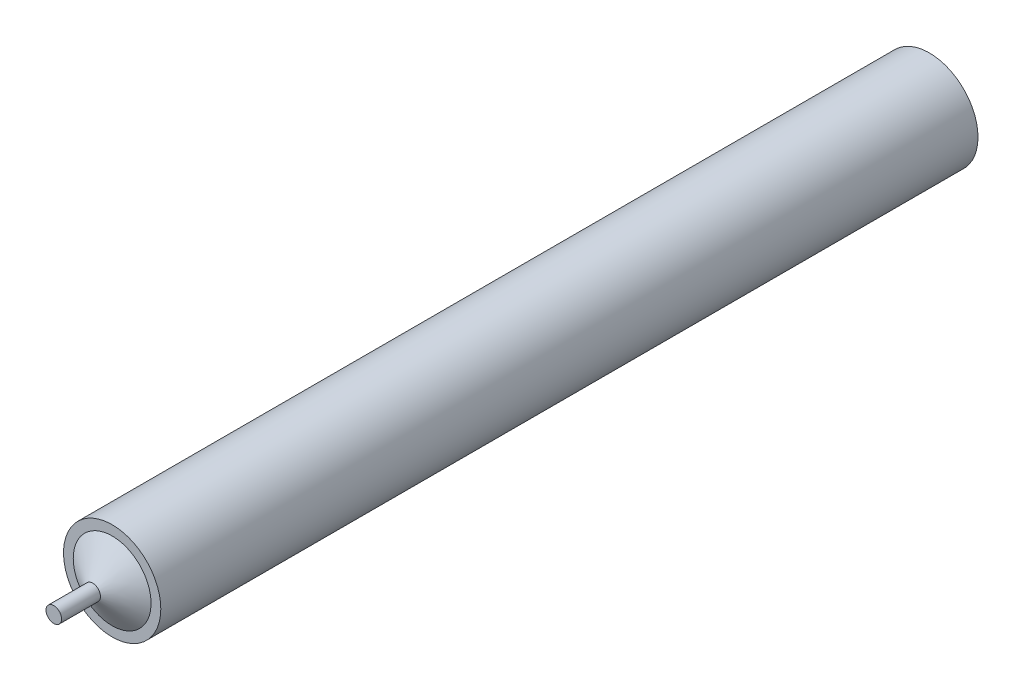
from build123d import *

# Parameters (mm, degrees)
SCHIZZO1_R                   = 25
ESTRUSIONE_ESTRUSIONE1_DEPTH = 420
SCHIZZO5_R                   = 4
SCHIZZO4_R                   = 20
SCHIZZO9_R                   = 4
ESTRUSIONE_ESTRUSIONE2_DEPTH = 20
SCHIZZO12_R                  = 2.5
TAGLIO_ESTRUSIONE2_DEPTH     = 25


with BuildPart() as part:
    # Schizzo1 → Estrusione-Estrusione1 (new body)
    with BuildSketch(Plane.XY):
        Circle(SCHIZZO1_R)
    extrude(amount=ESTRUSIONE_ESTRUSIONE1_DEPTH)

    # Schizzo5 → Loft2 section 0
    with BuildSketch(Plane.XY.offset(430)):
        Circle(SCHIZZO5_R)
    # Schizzo4 → Loft2 section 1
    with BuildSketch(Plane.XY.offset(420)):
        Circle(SCHIZZO4_R)
    loft()

    # Schizzo9 → Estrusione-Estrusione2 (add)
    with BuildSketch(Plane.XY.offset(430)):
        with Locations(Location((0, 0, 0), (0, 0, 180))):
            Circle(SCHIZZO9_R)
    extrude(amount=ESTRUSIONE_ESTRUSIONE2_DEPTH)

    # Loft3: read off the stored shape, not the designer's step
    # Loft3: loft between two sections, ruled curve by curve
    loft3_from = [
        Edge.make_bspline([(-8.012098274, 18.325017906, 0), (28.637937538, 34.349214454, 0), (44.662134086, -2.300821358, 0), (8.012098274, -18.325017906, 0), (-28.637937538, -34.349214454, 0), (-44.662134086, 2.300821358, 0), (-8.012098274, 18.325017906, 0)], [0, 0, 0, 0, 0.5, 0.5, 0.5, 1, 1, 1, 1], 3, [1, 0.333333333, 0.333333333, 1, 0.333333333, 0.333333333, 1]),
    ]
    loft3_to = [
        Edge.make_bspline([(-0.355363052, 2.474614536, -10), (4.59386602, 3.18534064, -10), (5.304592124, -1.763888432, -10), (0.355363052, -2.474614536, -10), (-4.59386602, -3.18534064, -10), (-5.304592124, 1.763888432, -10), (-0.355363052, 2.474614536, -10)], [0, 0, 0, 0, 0.5, 0.5, 0.5, 1, 1, 1, 1], 3, [1, 0.333333333, 0.333333333, 1, 0.333333333, 0.333333333, 1]),
    ]
    loft3 = Solid(Shell([*[Face.make_surface_from_curves(loft3_from[k], loft3_to[k]) for k in range(1)], Face(Wire(loft3_from)), Face(Wire(loft3_to))]))
    add(loft3)

    # Schizzo12 → Taglio-Estrusione2 (cut)
    with BuildSketch(Plane(origin=(0, 0, -10), x_dir=(-1, 0, 0), z_dir=(0, 0, -1))):
        Circle(SCHIZZO12_R)
    extrude(amount=-TAGLIO_ESTRUSIONE2_DEPTH, mode=Mode.SUBTRACT)


solid = part.part
